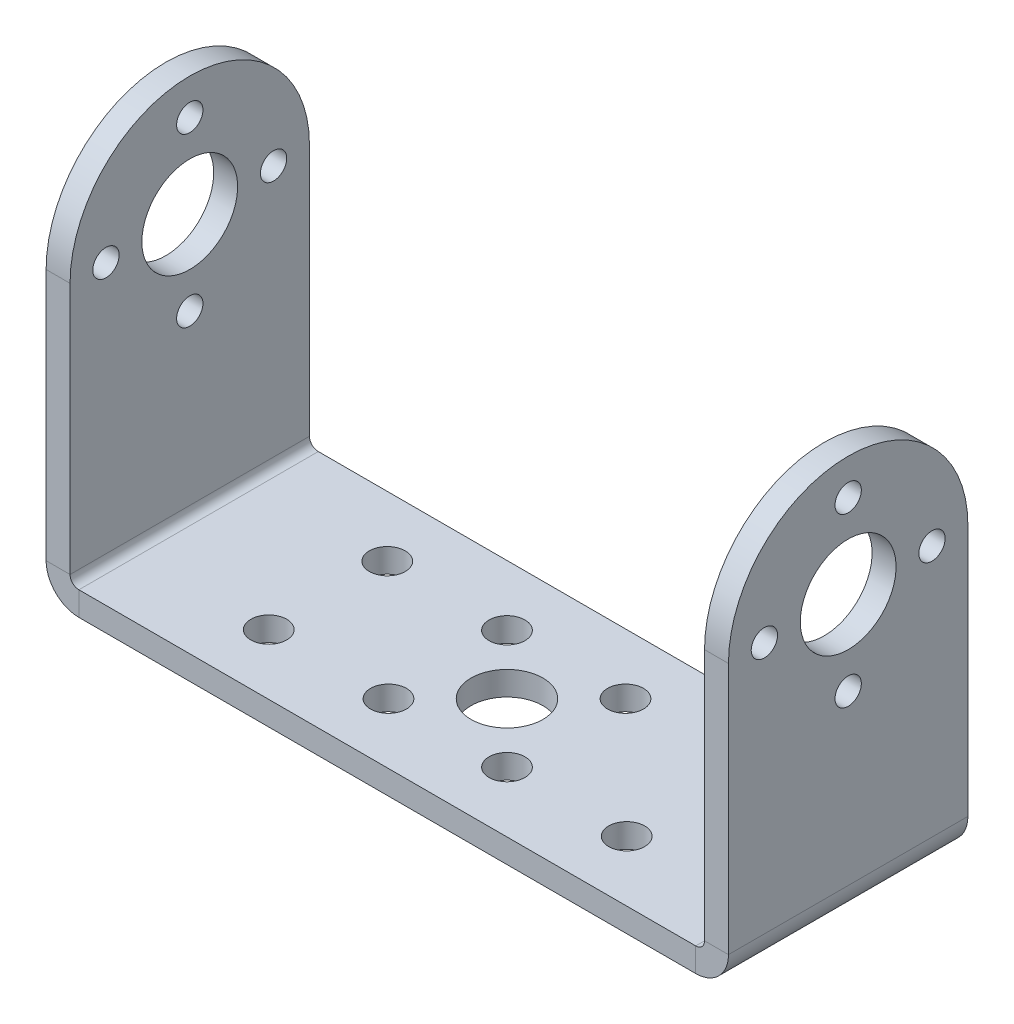
from build123d import *

# Parameters (mm, degrees)
SM_BASE_FLANGE_1_DEPTH = 20
EXTRUDE_1_DEPTH        = 2
EXTRUDE_START          = -2
EXTRUDE_2_DEPTH        = 2
SKETCH_8_R             = 4
SKETCH_8_R_2           = 1.1
CUT_EXTRUDE_1_DEPTH    = 65.618145883
SKETCH_9_R             = 3
SKETCH_9_R_2           = 1.5
CUT_EXTRUDE_2_DEPTH    = 2


# Sheet-metal steps are written as plain solids
with BuildPart() as part:
    # Sketch 1 → 基体-法兰1 (new body)
    with BuildSketch(Plane.XY):
        with BuildLine():
            Line((-12.079491004, 12.945691914), (-12.079491004, -8.117708086))
            ThreePointArc((-12.079491004, -8.117708086), (-11.863745859, -8.638562941), (-11.342891004, -8.854308086))
            Line((-11.342891004, -8.854308086), (40.183908996, -8.854308086))
            ThreePointArc((40.183908996, -8.854308086), (40.704763851, -8.638562941), (40.920508996, -8.117708086))
            Line((40.920508996, -8.117708086), (40.920508996, 12.945691914))
            Line((40.920508996, 12.945691914), (42.920508996, 12.945691914))
            Line((42.920508996, 12.945691914), (42.920508996, -8.117708086))
            ThreePointArc((42.920508996, -8.117708086), (42.118977413, -10.052776503), (40.183908996, -10.854308086))
            Line((40.183908996, -10.854308086), (-11.342891004, -10.854308086))
            ThreePointArc((-11.342891004, -10.854308086), (-13.277959422, -10.052776503), (-14.079491004, -8.117708086))
            Line((-14.079491004, -8.117708086), (-14.079491004, 12.945691914))
            Line((-14.079491004, 12.945691914), (-12.079491004, 12.945691914))
        make_face()
    extrude(amount=SM_BASE_FLANGE_1_DEPTH)

    # 草图6 → 凸台-拉伸1 (add)
    with BuildSketch(Plane.ZY.offset(14.079491004)):
        with BuildLine():
            Line((0, 12.945691914), (20, 12.945691914))
            ThreePointArc((20, 12.945691914), (10, 22.945691914), (0, 12.945691914))
        make_face()
    extrude(amount=-EXTRUDE_1_DEPTH)

    # 草图7 → 凸台-拉伸2 (add)
    with BuildSketch(Plane(origin=(42.920508996, 0, 0), x_dir=(0, 0, -1), z_dir=(1, 0, 0)).offset(EXTRUDE_START)):
        with BuildLine():
            Line((-20, 12.945691914), (0, 12.945691914))
            ThreePointArc((0, 12.945691914), (-10, 22.945691914), (-20, 12.945691914))
        make_face()
    extrude(amount=EXTRUDE_2_DEPTH)

    # 草图8 → 切除-拉伸1 (cut, through all)
    with BuildSketch(Plane.ZY.offset(14.079491004)):
        with Locations((10, 12.945691914)):
            Circle(SKETCH_8_R)
        with Locations((10, 19.945691914)):
            Circle(SKETCH_8_R_2)
        with Locations((17, 12.945691914)):
            Circle(SKETCH_8_R_2)
        with Locations((10, 5.945691914)):
            Circle(SKETCH_8_R_2)
        with Locations((3, 12.945691914)):
            Circle(SKETCH_8_R_2)
    extrude(amount=-CUT_EXTRUDE_1_DEPTH, mode=Mode.SUBTRACT)

    # 草图9 → 切除-拉伸2 (cut)
    with BuildSketch(Plane(origin=(0, -10.854308086, 0), x_dir=(-1, 0, 0), z_dir=(0, -1, 0))):
        with Locations(Location((-14.420508996, -10, 0), (0, 0, 90))):
            Circle(SKETCH_9_R)
        with Locations(Location((-29.370256464, -5.050252532, 0), (0, 0, 90))):
            Circle(SKETCH_9_R_2)
        with Locations(Location((-19.370256464, -5.050252532, 0), (0, 0, 90))):
            Circle(SKETCH_9_R_2)
        with Locations(Location((-9.470761527, -5.050252532, 0), (0, 0, 90))):
            Circle(SKETCH_9_R_2)
        with Locations(Location((-19.370256464, -14.949747468, 0), (0, 0, 90))):
            Circle(SKETCH_9_R_2)
        with Locations(Location((-9.470761527, -14.949747468, 0), (0, 0, 90))):
            Circle(SKETCH_9_R_2)
        with Locations(Location((-29.370256464, -14.949747468, 0), (0, 0, 90))):
            Circle(SKETCH_9_R_2)
        with Locations(Location((0.529238473, -5.050252532, 0), (0, 0, 90))):
            Circle(SKETCH_9_R_2)
        with Locations(Location((0.529238473, -14.949747468, 0), (0, 0, 90))):
            Circle(SKETCH_9_R_2)
    extrude(amount=-CUT_EXTRUDE_2_DEPTH, mode=Mode.SUBTRACT)


solid = part.part
